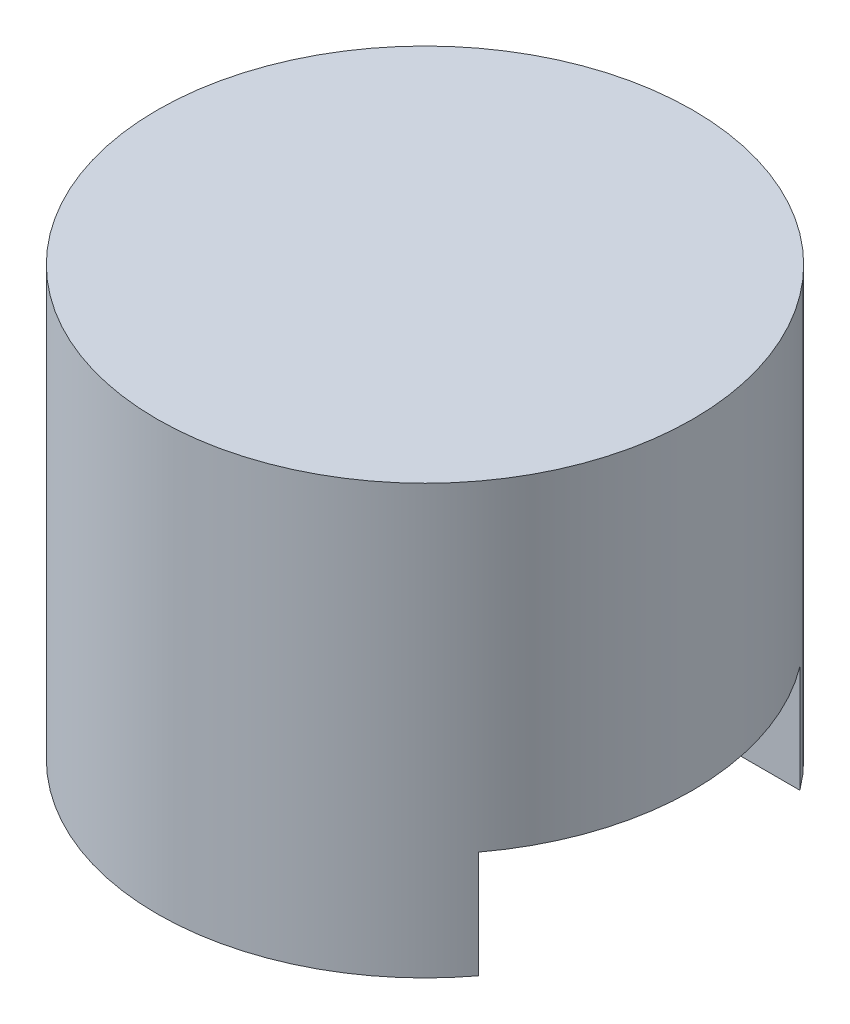
from build123d import *

# Parameters (mm, degrees)
SKETCH1_R               = 15.875
BOSS_EXTRUDE1_DEPTH     = 25.4
CUT_EXTRUDE1_DEPTH      = 34.89972345
CUT_EXTRUDE1_DEPTH_BACK = 34.89972345
SKETCH2_W               = 19.05
SKETCH2_H               = 12.7


with BuildPart() as part:
    # Sketch1 → Boss-Extrude1 (new body)
    with BuildSketch(Plane(origin=(0, 0, 0), x_dir=(1, 0, 0), z_dir=(0, 1, 0))):
        Circle(SKETCH1_R)
    extrude(amount=BOSS_EXTRUDE1_DEPTH)

    # Sketch2 → Cut-Extrude1 (cut, two sides: drawn at the far end of the back side and taken through both)
    with BuildSketch(Plane(origin=(0, 0, 0), x_dir=(0, 0, -1), z_dir=(1, 0, 0)).offset(-CUT_EXTRUDE1_DEPTH_BACK)):
        Rectangle(SKETCH2_W, SKETCH2_H)
    extrude(amount=CUT_EXTRUDE1_DEPTH + CUT_EXTRUDE1_DEPTH_BACK, mode=Mode.SUBTRACT)


solid = part.part
